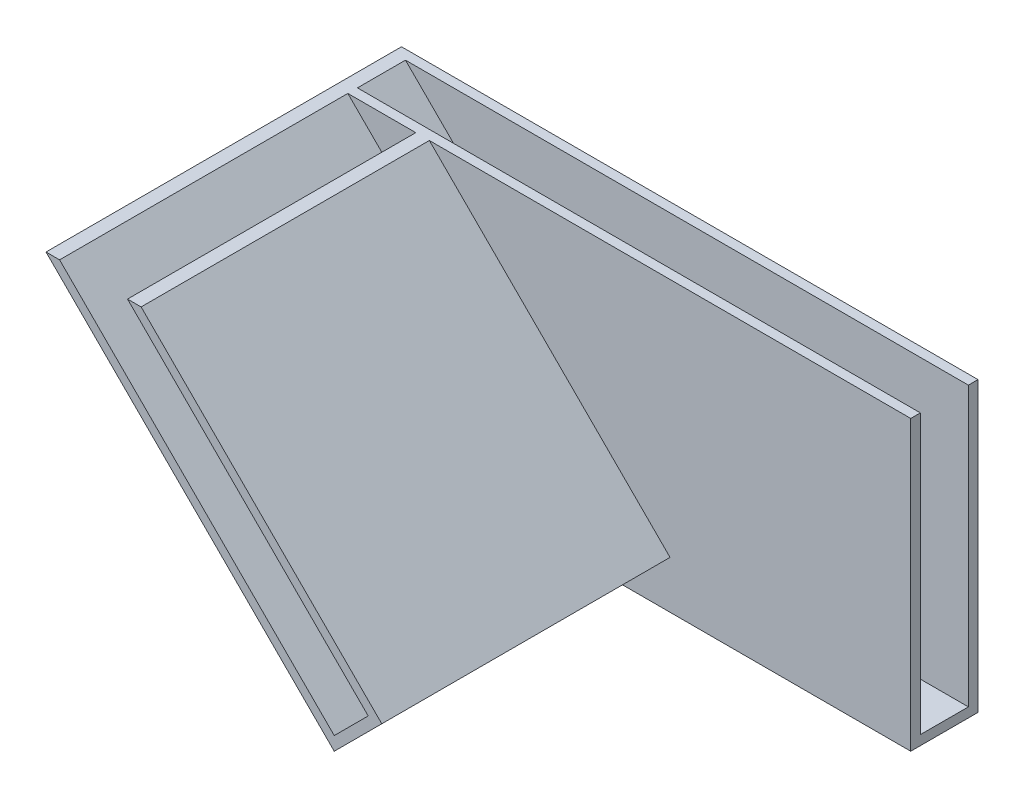
from build123d import *

# Parameters (mm, degrees)
SKETCH1_W           = 30
SKETCH1_H           = 30
BOSS_EXTRUDE1_DEPTH = 7
SKETCH2_W           = 7
SKETCH2_H           = 30
BOSS_EXTRUDE2_DEPTH = 30
CUT_EXTRUDE1_DEPTH  = 30
SHELL1_T            = -1
BOSS_EXTRUDE3_DEPTH = 30
SHELL2_START        = 7
SHELL2_DEPTH        = 30


# Read off the part's stored shape, not the designer's step: Shell2
with BuildPart() as part:
    # Sketch1 → Boss-Extrude1 (new body)
    with BuildSketch(Plane.XY):
        with Locations((15, 15)):
            Rectangle(SKETCH1_W, SKETCH1_H)
    extrude(amount=BOSS_EXTRUDE1_DEPTH)

    # Sketch2 → Boss-Extrude2 (add)
    with BuildSketch(Plane.ZY):
        with Locations((3.5, 15)):
            Rectangle(SKETCH2_W, SKETCH2_H)
    extrude(amount=BOSS_EXTRUDE2_DEPTH)

    # Sketch3 → Cut-Extrude1 (cut)
    with BuildSketch(Plane.XY.offset(7)):
        Polygon((-30, 30), (0, 0), (-30, 0), align=None)
    extrude(amount=-CUT_EXTRUDE1_DEPTH, mode=Mode.SUBTRACT)

    # Shell1
    shell1_openings = [part.faces().sort_by_distance(p)[0] for p in [
        (0, 30, 3.5),
        (30, 15, 3.5),
    ]]
    offset(amount=SHELL1_T, openings=shell1_openings, kind=Kind.INTERSECTION)

    # Sketch6 → Boss-Extrude3 (add)
    with BuildSketch(Plane.XY.offset(7)):
        Polygon((0, 0), (4.949747468, 4.949747468), (-20.100505063, 30), (-30, 30), align=None)
    extrude(amount=BOSS_EXTRUDE3_DEPTH)

    # Shell2 outline → Shell2 (cut)
    with BuildSketch(Plane.XY.offset(SHELL2_START)):
        Polygon((-28.585786438, 30), (0, 1.414213562), (3.535533906, 4.949747468), (-21.514718626, 30), align=None)
    extrude(amount=SHELL2_DEPTH, mode=Mode.SUBTRACT)


solid = part.part
